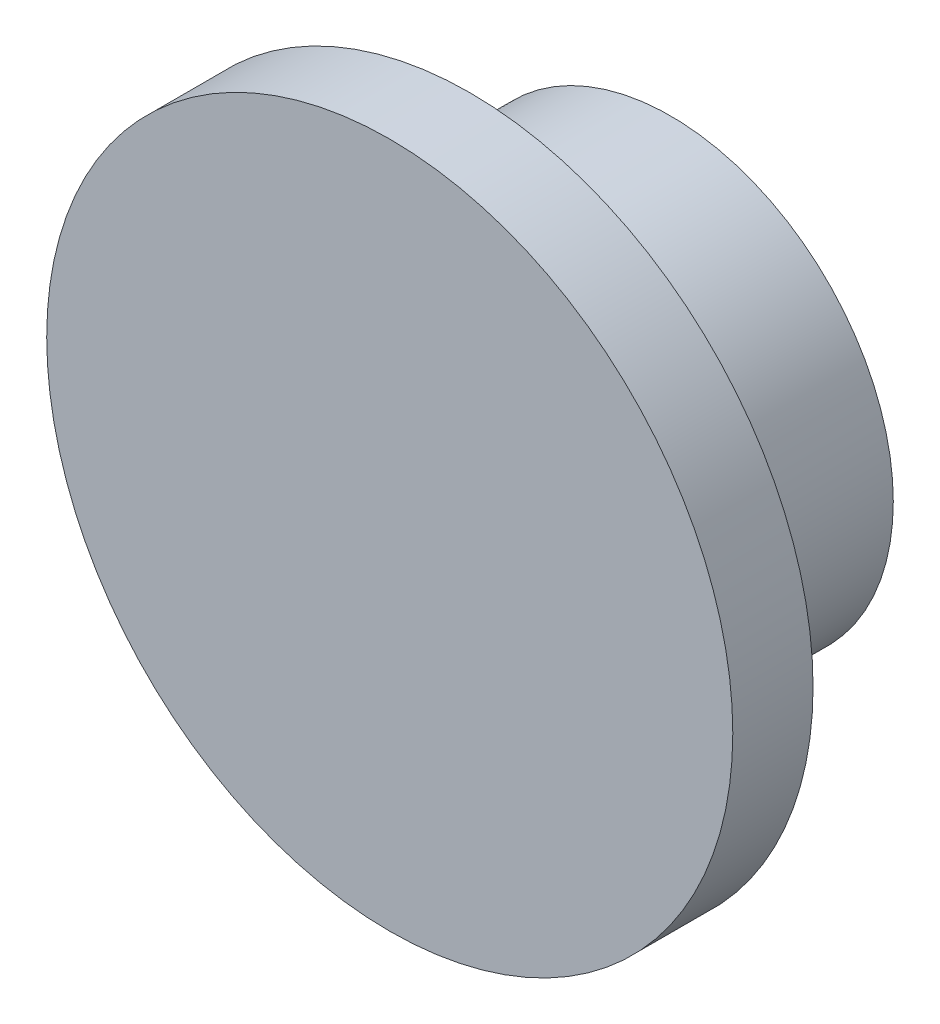
from build123d import *

# Parameters (mm, degrees)
SKETCH1_R           = 5.55
SKETCH1_R_2         = 2.55
BOSS_EXTRUDE1_DEPTH = 5
SKETCH2_R           = 8.55
BOSS_EXTRUDE2_DEPTH = 2
THREAD1_PITCH       = 0.8


with BuildPart() as part:
    # Sketch1 → Boss-Extrude1 (new body)
    with BuildSketch(Plane.XY):
        Circle(SKETCH1_R)
        Circle(SKETCH1_R_2, mode=Mode.SUBTRACT)
    extrude(amount=-BOSS_EXTRUDE1_DEPTH)

    # Sketch2 → Boss-Extrude2 (add)
    with BuildSketch(Plane.XY):
        Circle(SKETCH2_R)
    extrude(amount=BOSS_EXTRUDE2_DEPTH)

    # Thread1: the profile of Thread Profile1 profile screwed along a right-hand helix of 5.625 turns, 8 arcs to a turn; built about Z, then put on its axis
    thread1_z = Axis((0, 0, 0), (0, 0, 1))
    thread1_corners = [(2.5503, 0, -0.000173205), (2.5503, 0, 0.700173203), (2.1169873, 0, 0.449999999), (2.1169873, 0, 0.249999999)]
    with BuildLine(mode=Mode.PRIVATE) as thread1_profile:
        Line(thread1_corners[0], thread1_corners[1])
        Line(thread1_corners[1], thread1_corners[2])
        Line(thread1_corners[2], thread1_corners[3])
        Line(thread1_corners[3], thread1_corners[0])
    thread1_cap = Face(thread1_profile.wire())
    thread1_turn_angles = [0, 22.5, 45, 67.5, 90, 112.5, 135, 157.5, 180, 202.5, 225, 247.5, 270, 292.5, 315, 337.5, 360]
    thread1_turn_weights = [1, 0.9238795325112867, 1, 0.9238795325112867, 1, 0.9238795325112867, 1, 0.9238795325112867, 1, 0.9238795325112867, 1, 0.9238795325112867, 1, 0.9238795325112867, 1, 0.9238795325112867, 1]
    thread1_turn_rails = [Edge.make_bspline([Vector(p[0], p[1], 0).rotate(thread1_z, thread1_turn_angles[k]) / thread1_turn_weights[k] + Vector(0, 0, p[2] + THREAD1_PITCH * thread1_turn_angles[k] / 360) for k in range(17)], [0, 0, 0, 1, 1, 2, 2, 3, 3, 4, 4, 5, 5, 6, 6, 7, 7, 8, 8, 8], 2, thread1_turn_weights) for p in thread1_corners]
    thread1_turn_sides = [Face.make_surface_from_curves(thread1_turn_rails[p[0]], thread1_turn_rails[p[1]]) for p in [(0, 1), (1, 2), (2, 3), (3, 0)]]
    thread1_last_angles = [1800, 1822.5, 1845, 1867.5, 1890, 1912.5, 1935, 1957.5, 1980, 2002.5, 2025]
    thread1_last_weights = [1, 0.9238795325112867, 1, 0.9238795325112867, 1, 0.9238795325112867, 1, 0.9238795325112867, 1, 0.9238795325112867, 1]
    thread1_last_rails = [Edge.make_bspline([Vector(p[0], p[1], 0).rotate(thread1_z, thread1_last_angles[k]) / thread1_last_weights[k] + Vector(0, 0, p[2] + THREAD1_PITCH * thread1_last_angles[k] / 360) for k in range(11)], [0, 0, 0, 1, 1, 2, 2, 3, 3, 4, 4, 5, 5, 5], 2, thread1_last_weights) for p in thread1_corners]
    thread1_last_sides = [Face.make_surface_from_curves(thread1_last_rails[p[0]], thread1_last_rails[p[1]]) for p in [(0, 1), (1, 2), (2, 3), (3, 0)]]
    thread1 = Plane(origin=(0, 0, -5), x_dir=(1, 0, 0), z_dir=(0, 0, 1)) * Solid(Shell([*[p.moved(Location((0, 0, THREAD1_PITCH * i))) for i in range(5) for p in thread1_turn_sides], *thread1_last_sides, thread1_cap, thread1_cap.rotate(thread1_z, 2025).moved(Location((0, 0, THREAD1_PITCH * 2025 / 360)))]))
    add(thread1)


solid = part.part
